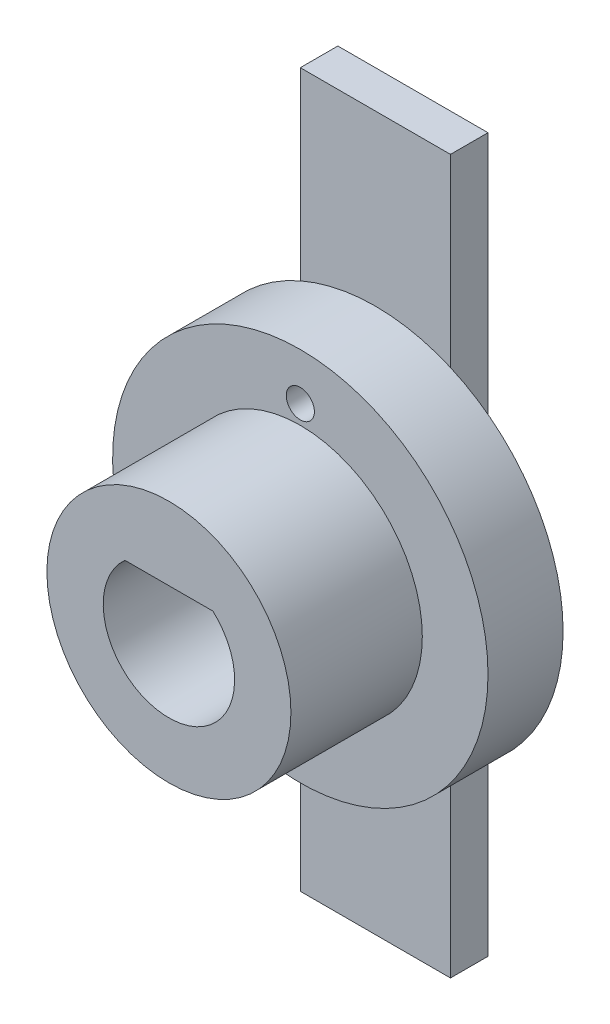
from build123d import *

# Parameters (mm, degrees)
ESQUISSE1_R        = 10
ESQUISSE1_R_2      = 0.75
BOSS_EXTRU_1_DEPTH = 4
ESQUISSE3_R        = 6.5
BOSS_EXTRU_2_DEPTH = 7
ESQUISSE4_W        = 8
ESQUISSE4_H        = 38
BOSS_EXTRU_3_DEPTH = 2


with BuildPart() as part:
    # Esquisse1 → Boss.-Extru.1 (new body)
    with BuildSketch(Plane.XY):
        Circle(ESQUISSE1_R)
        with Locations((0, -7.5)):
            Circle(ESQUISSE1_R_2, mode=Mode.SUBTRACT)
        with Locations((0, 7.5)):
            Circle(ESQUISSE1_R_2, mode=Mode.SUBTRACT)
    extrude(amount=BOSS_EXTRU_1_DEPTH)

    # Esquisse3 → Boss.-Extru.2 (add)
    with BuildSketch(Plane.XY.offset(4)):
        Circle(ESQUISSE3_R)
        with BuildLine():
            Line((-2.343074903, 2.6), (2.343074903, 2.6))
            ThreePointArc((2.343074903, 2.6), (0, -3.5), (-2.343074903, 2.6))
        make_face(mode=Mode.SUBTRACT)
    extrude(amount=BOSS_EXTRU_2_DEPTH)

    # Esquisse4 → Boss.-Extru.3 (add)
    with BuildSketch(Plane(origin=(0, 0, 0), x_dir=(-1, 0, 0), z_dir=(0, 0, -1))):
        Rectangle(ESQUISSE4_W, ESQUISSE4_H)
    extrude(amount=BOSS_EXTRU_3_DEPTH)


solid = part.part
